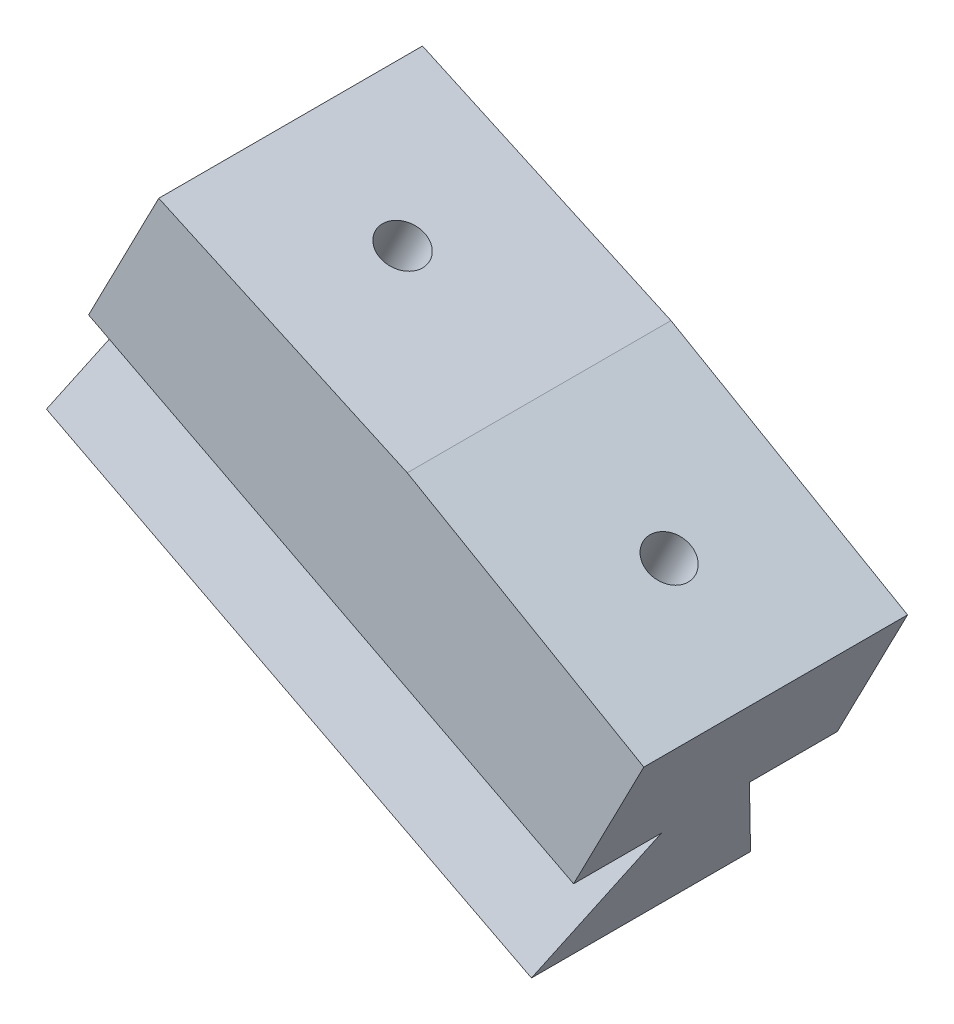
from build123d import *

# Parameters (mm, degrees)
STOCK_SPIRALE_ENROUL_E_1_START = -7.5
STOCK_SPIRALE_ENROUL_E_1_DEPTH = 15
BOSS_EXTRU_1_DEPTH             = 15
ENL_V_MAT_EXTRU_1_REACH        = 41.844
ESQUISSE40_R                   = 1.25
ENL_V_MAT_EXTRU_39_DEPTH       = 0.1
ESQUISSE45_R                   = 1.25
ENL_V_MAT_EXTRU_44_DEPTH       = 54.34000069


# Read off the part's stored shape, not the designer's step: Stock-spirale_enroulée-1
with BuildPart() as part:
    # Stock-spirale_enroulée-1 outline → Stock-spirale_enroulée-1 (new body)
    with BuildSketch(Plane.XY.offset(STOCK_SPIRALE_ENROUL_E_1_START)):
        Polygon((-32.409116649, 0), (-14.945224597, 0), (-12.326158681, 5.078291377), (-25.783924084, 12.848135855), (-39.918116919, 19.306194835), (-42.53651187, 14.227557472), align=None)
    extrude(amount=STOCK_SPIRALE_ENROUL_E_1_DEPTH)

    # Esquisse1 → Boss.-Extru.1 (add)
    with BuildSketch(Plane.XY.offset(7.5)):
        Polygon((-42.53651187, 14.227557472), (-32.409116649, 0), (-14.945224597, 0), (-19.987274825, -9.776386321), (-47.576330697, 4.452327735), align=None)
    extrude(amount=-BOSS_EXTRU_1_DEPTH)

    # Enlèv. mat.-Extru.1: up to this plane
    enl_v_mat_extru_1_end = Plane(origin=(-39.918116919, 19.306194835, 7.5), z_dir=(0.8888229444852807, -0.45825077562020095, 0))
    # Esquisse2 → Enlèv. mat.-Extru.1 (cut, up to the surface)
    with BuildSketch(Plane(origin=(-11.805211849, 6.088391881, 0), x_dir=(0, 0, -1), z_dir=(0.8887623928011207, -0.4583682025865522, 0)), mode=Mode.PRIVATE) as enl_v_mat_extru_1_sk1:
        Polygon((-7.5, -9.850415736), (-2.5, -9.850415736), (-6.230461265, -17.850415736), (-7.5, -17.850415736), align=None)
    enl_v_mat_extru_1_tool1 = split(extrude(enl_v_mat_extru_1_sk1.sketch, amount=-ENL_V_MAT_EXTRU_1_REACH, mode=Mode.PRIVATE), bisect_by=enl_v_mat_extru_1_end, keep=Keep.BOTH, mode=Mode.PRIVATE)
    add(enl_v_mat_extru_1_tool1.solids().sort_by_distance((-17.790155, -5.516236, 5.747642))[0], mode=Mode.SUBTRACT)
    # Esquisse2 → Enlèv. mat.-Extru.1 (cut, up to the surface)
    with BuildSketch(Plane(origin=(-11.805211849, 6.088391881, 0), x_dir=(0, 0, -1), z_dir=(0.8887623928011207, -0.4583682025865522, 0)), mode=Mode.PRIVATE) as enl_v_mat_extru_1_sk2:
        Polygon((6.230461265, -17.850415736), (2.5, -9.850415736), (7.5, -9.850415736), (7.5, -17.850415736), align=None)
    enl_v_mat_extru_1_tool2 = split(extrude(enl_v_mat_extru_1_sk2.sketch, amount=-ENL_V_MAT_EXTRU_1_REACH, mode=Mode.PRIVATE), bisect_by=enl_v_mat_extru_1_end, keep=Keep.BOTH, mode=Mode.PRIVATE)
    add(enl_v_mat_extru_1_tool2.solids().sort_by_distance((-17.790155, -5.516236, -5.747642))[0], mode=Mode.SUBTRACT)

    # Esquisse40 → Enlèv. mat.-Extru.39 (cut)
    with BuildSketch(Plane(origin=(-35.583416905, -1.7328691, -7.5), x_dir=(0.8887623928011112, -0.4583682025865705, 0), z_dir=(-0.4583682025865705, -0.8887623928011112, 0))):
        with Locations((-6.504075816, 7.5)):
            Circle(ESQUISSE40_R)
        with Locations((10.556032704, 7.5)):
            Circle(ESQUISSE40_R)
    extrude(amount=-ENL_V_MAT_EXTRU_39_DEPTH, mode=Mode.SUBTRACT)

    # Esquisse45 → Enlèv. mat.-Extru.44 (cut, through all)
    with BuildSketch(Plane(origin=(-8.182062976, -15.864778202, 0), x_dir=(0.8887623928011112, -0.4583682025865705, 0), z_dir=(-0.4583682025865705, -0.8887623928011112, 0))):
        with Locations((-37.334986474, 0)):
            Circle(ESQUISSE45_R)
        with Locations((-20.274877954, 0)):
            Circle(ESQUISSE45_R)
    extrude(amount=-ENL_V_MAT_EXTRU_44_DEPTH, mode=Mode.SUBTRACT)


solid = part.part
